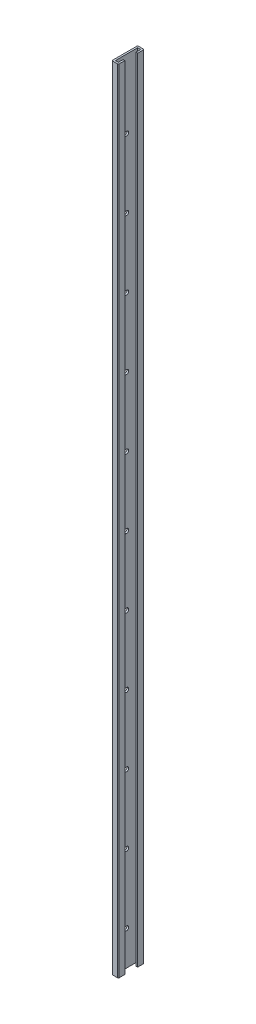
from build123d import *

# Parameters (mm, degrees)
BOSS_EXTRUDE1_DEPTH = 1168.4
CUT_EXTRUDE1_REACH  = 1170.962
SKETCH2_R           = 3.175


with BuildPart() as part:
    # Sketch1 → Boss-Extrude1 (new body)
    with BuildSketch(Plane(origin=(0, 0, 0), x_dir=(1, 0, 0), z_dir=(0, 1, 0))):
        with BuildLine():
            Line((9.525, 34.29), (9.525, 26.035))
            Line((9.525, 26.035), (6.985, 26.035))
            Line((6.985, 26.035), (6.985, 33.02))
            Line((6.985, 33.02), (2.54, 33.02))
            Line((2.54, 33.02), (2.54, 0))
            Line((2.54, 0), (6.985, 0))
            Line((6.985, 0), (6.985, 6.985))
            Line((6.985, 6.985), (9.525, 6.985))
            Line((9.525, 6.985), (9.525, -1.27))
            ThreePointArc((9.525, -1.27), (9.153025612, -2.168025612), (8.255, -2.54))
            Line((8.255, -2.54), (1.27, -2.54))
            ThreePointArc((1.27, -2.54), (0.371974388, -2.168025612), (0, -1.27))
            Line((0, -1.27), (0, 34.29))
            ThreePointArc((0, 34.29), (0.371974388, 35.188025612), (1.27, 35.56))
            Line((1.27, 35.56), (8.255, 35.56))
            ThreePointArc((8.255, 35.56), (9.153025612, 35.188025612), (9.525, 34.29))
        make_face()
    extrude(amount=BOSS_EXTRUDE1_DEPTH)

    # Sketch2 → Cut-Extrude1 (cut, up to next)
    with BuildSketch(Plane(origin=(2.54, 0, 0), x_dir=(0, 0, -1), z_dir=(1, 0, 0)), mode=Mode.PRIVATE) as cut_extrude1_sk1:
        with Locations((16.51, 50.8)):
            Circle(SKETCH2_R)
    cut_extrude1_tool1 = extrude(cut_extrude1_sk1.sketch, amount=-CUT_EXTRUDE1_REACH, mode=Mode.PRIVATE) & part.part
    # Sketch2 → Cut-Extrude1 (cut, up to next)
    with BuildSketch(Plane(origin=(2.54, 0, 0), x_dir=(0, 0, -1), z_dir=(1, 0, 0)), mode=Mode.PRIVATE) as cut_extrude1_sk2:
        with Locations((16.51, 152.4)):
            Circle(SKETCH2_R)
    cut_extrude1_tool2 = extrude(cut_extrude1_sk2.sketch, amount=-CUT_EXTRUDE1_REACH, mode=Mode.PRIVATE) & part.part
    # Sketch2 → Cut-Extrude1 (cut, up to next)
    with BuildSketch(Plane(origin=(2.54, 0, 0), x_dir=(0, 0, -1), z_dir=(1, 0, 0)), mode=Mode.PRIVATE) as cut_extrude1_sk3:
        with Locations((16.51, 254)):
            Circle(SKETCH2_R)
    cut_extrude1_tool3 = extrude(cut_extrude1_sk3.sketch, amount=-CUT_EXTRUDE1_REACH, mode=Mode.PRIVATE) & part.part
    # Sketch2 → Cut-Extrude1 (cut, up to next)
    with BuildSketch(Plane(origin=(2.54, 0, 0), x_dir=(0, 0, -1), z_dir=(1, 0, 0)), mode=Mode.PRIVATE) as cut_extrude1_sk4:
        with Locations((16.51, 355.6)):
            Circle(SKETCH2_R)
    cut_extrude1_tool4 = extrude(cut_extrude1_sk4.sketch, amount=-CUT_EXTRUDE1_REACH, mode=Mode.PRIVATE) & part.part
    # Sketch2 → Cut-Extrude1 (cut, up to next)
    with BuildSketch(Plane(origin=(2.54, 0, 0), x_dir=(0, 0, -1), z_dir=(1, 0, 0)), mode=Mode.PRIVATE) as cut_extrude1_sk5:
        with Locations((16.51, 457.2)):
            Circle(SKETCH2_R)
    cut_extrude1_tool5 = extrude(cut_extrude1_sk5.sketch, amount=-CUT_EXTRUDE1_REACH, mode=Mode.PRIVATE) & part.part
    # Sketch2 → Cut-Extrude1 (cut, up to next)
    with BuildSketch(Plane(origin=(2.54, 0, 0), x_dir=(0, 0, -1), z_dir=(1, 0, 0)), mode=Mode.PRIVATE) as cut_extrude1_sk6:
        with Locations((16.51, 558.8)):
            Circle(SKETCH2_R)
    cut_extrude1_tool6 = extrude(cut_extrude1_sk6.sketch, amount=-CUT_EXTRUDE1_REACH, mode=Mode.PRIVATE) & part.part
    # Sketch2 → Cut-Extrude1 (cut, up to next)
    with BuildSketch(Plane(origin=(2.54, 0, 0), x_dir=(0, 0, -1), z_dir=(1, 0, 0)), mode=Mode.PRIVATE) as cut_extrude1_sk7:
        with Locations((16.51, 660.4)):
            Circle(SKETCH2_R)
    cut_extrude1_tool7 = extrude(cut_extrude1_sk7.sketch, amount=-CUT_EXTRUDE1_REACH, mode=Mode.PRIVATE) & part.part
    # Sketch2 → Cut-Extrude1 (cut, up to next)
    with BuildSketch(Plane(origin=(2.54, 0, 0), x_dir=(0, 0, -1), z_dir=(1, 0, 0)), mode=Mode.PRIVATE) as cut_extrude1_sk8:
        with Locations((16.51, 762)):
            Circle(SKETCH2_R)
    cut_extrude1_tool8 = extrude(cut_extrude1_sk8.sketch, amount=-CUT_EXTRUDE1_REACH, mode=Mode.PRIVATE) & part.part
    # Sketch2 → Cut-Extrude1 (cut, up to next)
    with BuildSketch(Plane(origin=(2.54, 0, 0), x_dir=(0, 0, -1), z_dir=(1, 0, 0)), mode=Mode.PRIVATE) as cut_extrude1_sk9:
        with Locations((16.51, 863.6)):
            Circle(SKETCH2_R)
    cut_extrude1_tool9 = extrude(cut_extrude1_sk9.sketch, amount=-CUT_EXTRUDE1_REACH, mode=Mode.PRIVATE) & part.part
    # Sketch2 → Cut-Extrude1 (cut, up to next)
    with BuildSketch(Plane(origin=(2.54, 0, 0), x_dir=(0, 0, -1), z_dir=(1, 0, 0)), mode=Mode.PRIVATE) as cut_extrude1_sk10:
        with Locations((16.51, 965.2)):
            Circle(SKETCH2_R)
    cut_extrude1_tool10 = extrude(cut_extrude1_sk10.sketch, amount=-CUT_EXTRUDE1_REACH, mode=Mode.PRIVATE) & part.part
    # Sketch2 → Cut-Extrude1 (cut, up to next)
    with BuildSketch(Plane(origin=(2.54, 0, 0), x_dir=(0, 0, -1), z_dir=(1, 0, 0)), mode=Mode.PRIVATE) as cut_extrude1_sk11:
        with Locations((16.51, 1066.8)):
            Circle(SKETCH2_R)
    cut_extrude1_tool11 = extrude(cut_extrude1_sk11.sketch, amount=-CUT_EXTRUDE1_REACH, mode=Mode.PRIVATE) & part.part
    add(cut_extrude1_tool1.solids().sort_by_distance((2.54, 50.8, -16.51))[0], mode=Mode.SUBTRACT)
    add(cut_extrude1_tool2.solids().sort_by_distance((2.54, 152.4, -16.51))[0], mode=Mode.SUBTRACT)
    add(cut_extrude1_tool3.solids().sort_by_distance((2.54, 254, -16.51))[0], mode=Mode.SUBTRACT)
    add(cut_extrude1_tool4.solids().sort_by_distance((2.54, 355.6, -16.51))[0], mode=Mode.SUBTRACT)
    add(cut_extrude1_tool5.solids().sort_by_distance((2.54, 457.2, -16.51))[0], mode=Mode.SUBTRACT)
    add(cut_extrude1_tool6.solids().sort_by_distance((2.54, 558.8, -16.51))[0], mode=Mode.SUBTRACT)
    add(cut_extrude1_tool7.solids().sort_by_distance((2.54, 660.4, -16.51))[0], mode=Mode.SUBTRACT)
    add(cut_extrude1_tool8.solids().sort_by_distance((2.54, 762, -16.51))[0], mode=Mode.SUBTRACT)
    add(cut_extrude1_tool9.solids().sort_by_distance((2.54, 863.6, -16.51))[0], mode=Mode.SUBTRACT)
    add(cut_extrude1_tool10.solids().sort_by_distance((2.54, 965.2, -16.51))[0], mode=Mode.SUBTRACT)
    add(cut_extrude1_tool11.solids().sort_by_distance((2.54, 1066.8, -16.51))[0], mode=Mode.SUBTRACT)


solid = part.part
